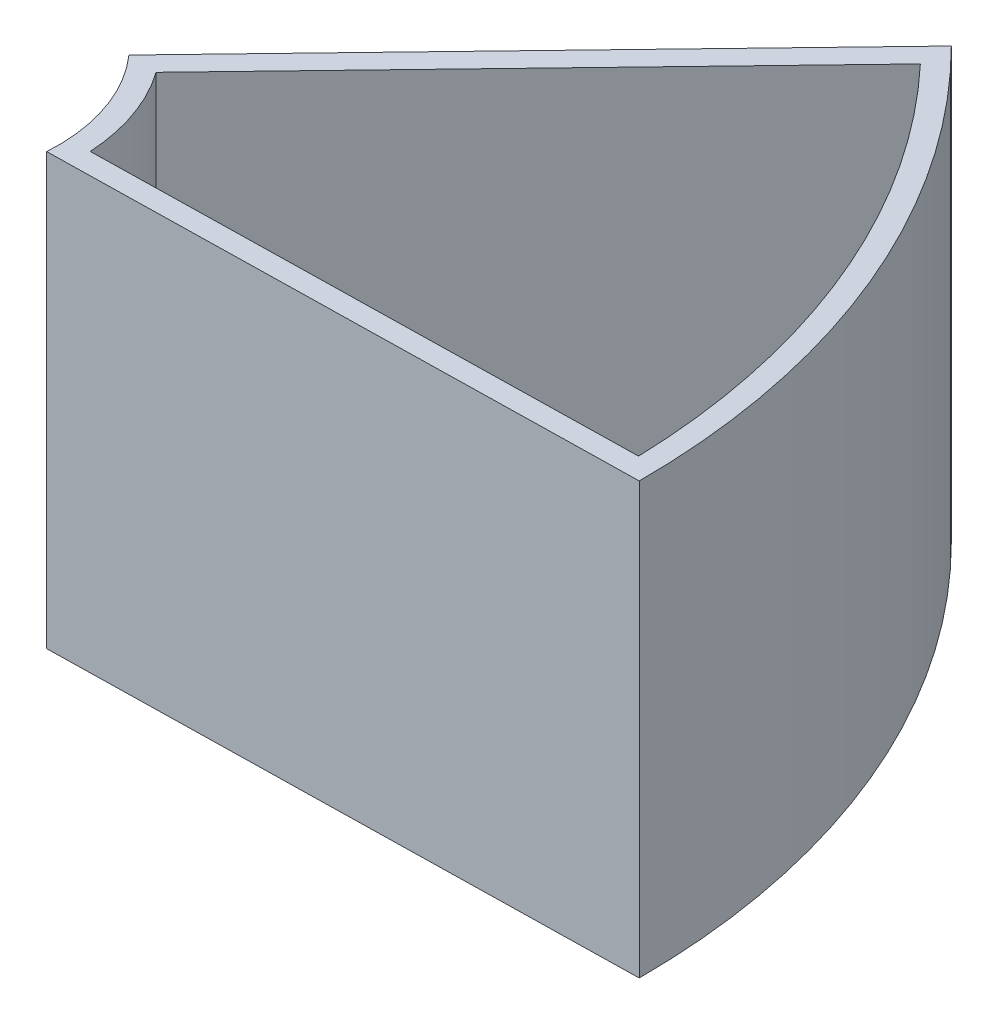
from build123d import *

# Parameters (mm, degrees)
BOSS_EXTRUDE1_DEPTH = 100
BOSS_EXTRUDE3_DEPTH = 15


with BuildPart() as part:
    # Sketch3 → Boss-Extrude1 (new body)
    with BuildSketch(Plane(origin=(0, 0, 0), x_dir=(1, 0, 0), z_dir=(0, 1, 0))):
        with BuildLine():
            Line((123.743686708, 123.743686708), (30.045678616, 26.405628121))
            ThreePointArc((30.045678616, 26.405628121), (37.863583917, 12.897635944), (39.917101801, -2.573904389))
            Line((39.917101801, -2.573904389), (175, 0))
            ThreePointArc((175, 0), (161.678918189, 66.969600664), (123.743686708, 123.743686708))
        make_face()
        with BuildLine():
            Line((36.672129032, 26.079780525), (123.758669753, 116.549524499))
            ThreePointArc((123.758669753, 116.549524499), (157.096506553, 64.966819445), (169.929243976, 4.904288086))
            Line((169.929243976, 4.904288086), (44.929243976, 2.52250584))
            ThreePointArc((44.929243976, 2.52250584), (42.466837849, 14.885149752), (36.672129032, 26.079780525))
        make_face(mode=Mode.SUBTRACT)
    extrude(amount=BOSS_EXTRUDE1_DEPTH)

    # Sketch5 → Boss-Extrude3 (add)
    with BuildSketch(Plane(origin=(0, 0, 0), x_dir=(1, 0, 0), z_dir=(0, 1, 0))):
        with BuildLine():
            ThreePointArc((175, 0), (161.678918189, 66.969600664), (123.743686708, 123.743686708))
            Line((123.743686708, 123.743686708), (30.045678616, 26.405628121))
            ThreePointArc((30.045678616, 26.405628121), (37.863583917, 12.897635944), (39.917101801, -2.573904389))
            Line((39.917101801, -2.573904389), (175, 0))
        make_face()
    extrude(amount=BOSS_EXTRUDE3_DEPTH)


solid = part.part
